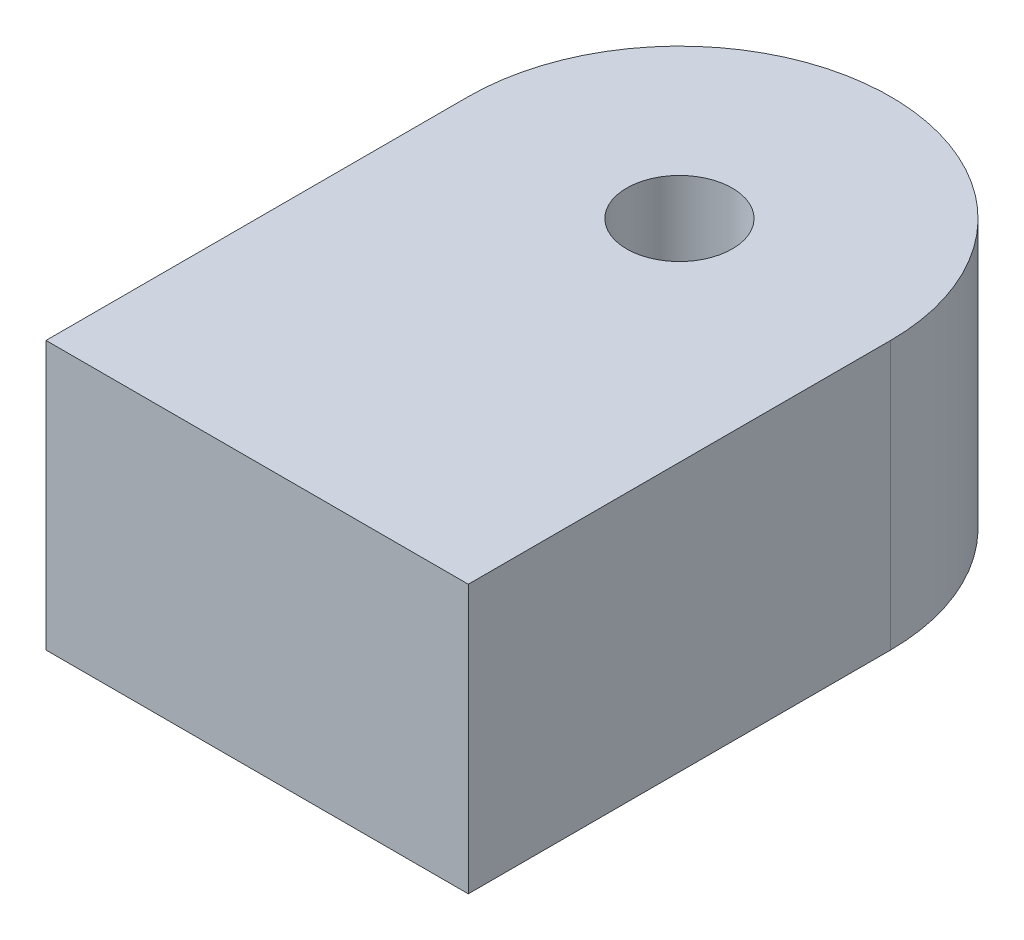
from build123d import *

# Parameters (mm, degrees)
SKETCH1_R      = 2.5
FASTENER_DEPTH = 12.7


with BuildPart() as part:
    # Sketch1 → Fastener (new body)
    with BuildSketch(Plane(origin=(0, 0, 0), x_dir=(1, 0, 0), z_dir=(0, 1, 0))):
        with BuildLine():
            Line((-10, 0), (-10, -20))
            Line((-10, -20), (10, -20))
            Line((10, -20), (10, 0))
            ThreePointArc((10, 0), (0, 10), (-10, 0))
        make_face()
        Circle(SKETCH1_R, mode=Mode.SUBTRACT)
    extrude(amount=FASTENER_DEPTH)


solid = part.part
